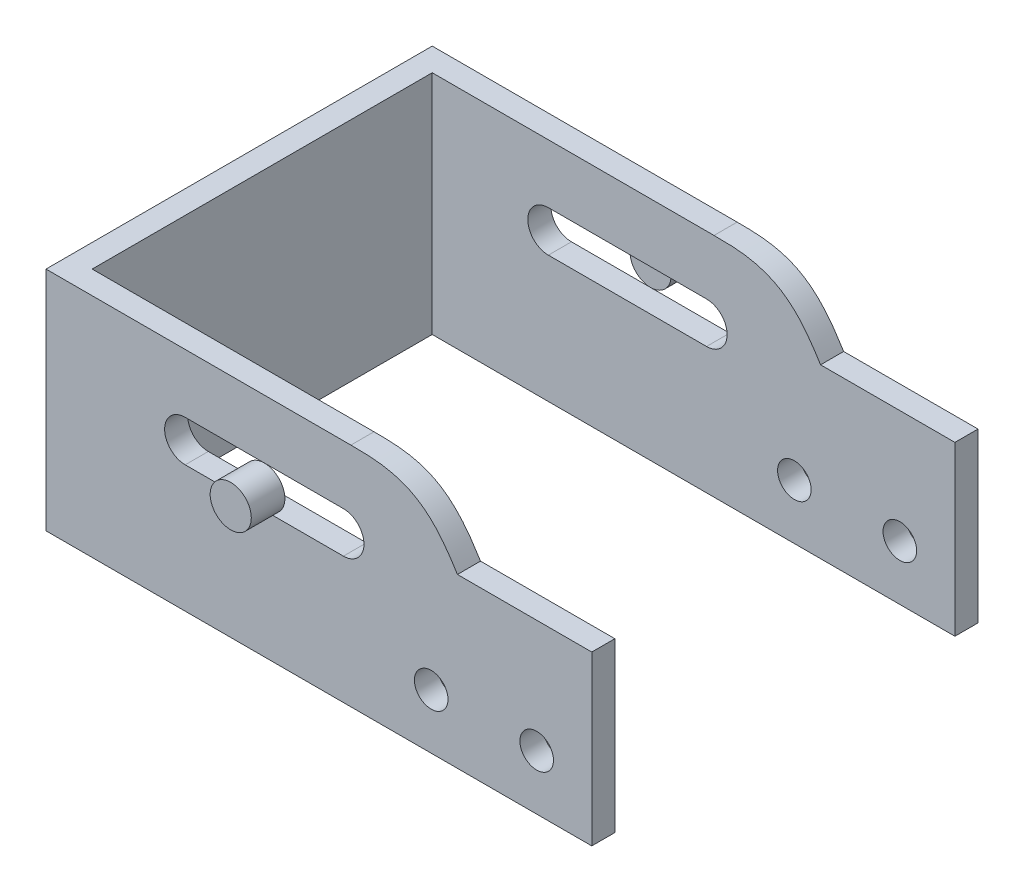
from build123d import *

# Parameters (mm, degrees)
BOSS_EXTRUDE1_DEPTH     = 2.75
FILLET1_START           = -1
FILLET1_DEPTH           = 5
CUT_EXTRUDE1_DEPTH      = 36.299610618
SKETCH4_W               = 2.75
SKETCH4_H               = 27
BOSS_EXTRUDE2_DEPTH     = 43.25
LPATTERN2_COUNT         = 2
LPATTERN2_PITCH         = 43.25
LPATTERN3_START         = 43.25
LPATTERN3_DEPTH         = 2.75
SKETCH6_R               = 2.45
BOSS_EXTRUDE3_DEPTH     = 4
LPATTERN4_COUNT         = 2
LPATTERN4_PITCH         = 50
CUT_EXTRUDE2_DEPTH      = 62.14327444
CUT_EXTRUDE2_DEPTH_BACK = 62.14327444
SKETCH7_R               = 2
FILLET3_START           = 43.25
FILLET3_DEPTH           = 3.75


with BuildPart() as part:
    # Sketch1 → Boss-Extrude1 (new body)
    with BuildSketch(Plane.XY):
        Polygon((-32.5, -13.5), (32.5, -13.5), (32.5, 6.5), (16.5, 6.5), (16.5, 13.5), (-32.5, 13.5), align=None)
    boss_extrude1 = extrude(amount=BOSS_EXTRUDE1_DEPTH)

    # Fillet1: read off the stored shape, not the designer's step
    # Fillet1 outline → Fillet1 (cut)
    with BuildSketch(Plane.XY.offset(FILLET1_START)):
        with BuildLine():
            Line((16.5, 13.5), (3.81142246, 13.5))
            add(Edge.make_bspline(
                [(3.81142246, 13.5), (5.301266164, 13.5), (6.791109869, 13.5), (10.115693614, 13.127081209), (12.822268118, 11.633925537), (14.910833382, 9.020532983), (15.705416691, 7.760266491), (16.5, 6.5)],
                knots=[0, 0, 0, 0, 0, 0, 0.5, 0.5, 1, 1, 1, 1, 1, 1], degree=5))
            Line((16.5, 6.5), (16.5, 13.5))
        make_face()
    extrude(amount=FILLET1_DEPTH, mode=Mode.SUBTRACT)

    # Sketch2 → Cut-Extrude1 (cut, symmetric)
    with BuildSketch(Plane.XY.offset(2.75)):
        with BuildLine():
            Line((-15.92, 1.6), (2.92, 1.6))
            ThreePointArc((2.92, 1.6), (5.37, 4.05), (2.92, 6.5))
            Line((2.92, 6.5), (-15.92, 6.5))
            ThreePointArc((-15.92, 6.5), (-18.37, 4.05), (-15.92, 1.6))
        make_face()
    extrude(amount=CUT_EXTRUDE1_DEPTH, both=True, mode=Mode.SUBTRACT)

    # Sketch4 → Boss-Extrude2 (add)
    with BuildSketch(Plane.XY.offset(2.75)):
        with Locations((-31.125, 0)):
            Rectangle(SKETCH4_W, SKETCH4_H)
    extrude(amount=BOSS_EXTRUDE2_DEPTH)

    # LPattern2: Boss-Extrude1 ×2
    with Locations(*[(0, 0, i * LPATTERN2_PITCH) for i in range(1, LPATTERN2_COUNT)]):
        add(boss_extrude1)

    # LPattern3: read off the stored shape, not the designer's step
    # LPattern3 outline → LPattern3 (cut)
    with BuildSketch(Plane.XY.offset(LPATTERN3_START)):
        with BuildLine():
            Line((2.92, 6.5), (-15.92, 6.5))
            ThreePointArc((-15.92, 6.5), (-18.37, 4.05), (-15.92, 1.6))
            Line((-15.92, 1.6), (2.92, 1.6))
            ThreePointArc((2.92, 1.6), (5.37, 4.05), (2.92, 6.5))
        make_face()
    extrude(amount=LPATTERN3_DEPTH, mode=Mode.SUBTRACT)

    # Sketch7 → Cut-Extrude2 (cut, two sides: drawn at the far end of the back side and taken through both)
    with BuildSketch(Plane.XY.offset(46).offset(-CUT_EXTRUDE2_DEPTH_BACK)):
        with Locations(Location((13.38, -6.955, 0), (0, 0, 180))):
            Circle(SKETCH7_R)
        with Locations(Location((25.94, -6.955, 0), (0, 0, 180))):
            Circle(SKETCH7_R)
    extrude(amount=CUT_EXTRUDE2_DEPTH + CUT_EXTRUDE2_DEPTH_BACK, mode=Mode.SUBTRACT)

    # Fillet3: read off the stored shape, not the designer's step
    # Fillet3 outline → Fillet3 (cut)
    with BuildSketch(Plane.XY.offset(FILLET3_START)):
        with BuildLine():
            Line((16.5, 13.5), (3.81142246, 13.5))
            add(Edge.make_bspline(
                [(3.81142246, 13.5), (5.301266164, 13.5), (6.791109869, 13.5), (10.115693614, 13.127081209), (12.822268118, 11.633925537), (14.910833382, 9.020532983), (15.705416691, 7.760266491), (16.5, 6.5)],
                knots=[0, 0, 0, 0, 0, 0, 0.5, 0.5, 1, 1, 1, 1, 1, 1], degree=5))
            Line((16.5, 6.5), (16.5, 13.5))
        make_face()
    extrude(amount=FILLET3_DEPTH, mode=Mode.SUBTRACT)


with BuildPart() as body_2:
    # Sketch6 → Boss-Extrude3 (new body)
    with BuildSketch(Plane.XY.offset(46)):
        with Locations((-6.5, 4.05)):
            Circle(SKETCH6_R)
    boss_extrude3 = extrude(amount=BOSS_EXTRUDE3_DEPTH)


with BuildPart() as lpattern4_1:
    # LPattern4: Boss-Extrude3 ×2
    with Locations(*[(0, 0, -i * LPATTERN4_PITCH) for i in range(1, LPATTERN4_COUNT)]):
        add(boss_extrude3)


solid = Compound([part.part, body_2.part, lpattern4_1.part])
